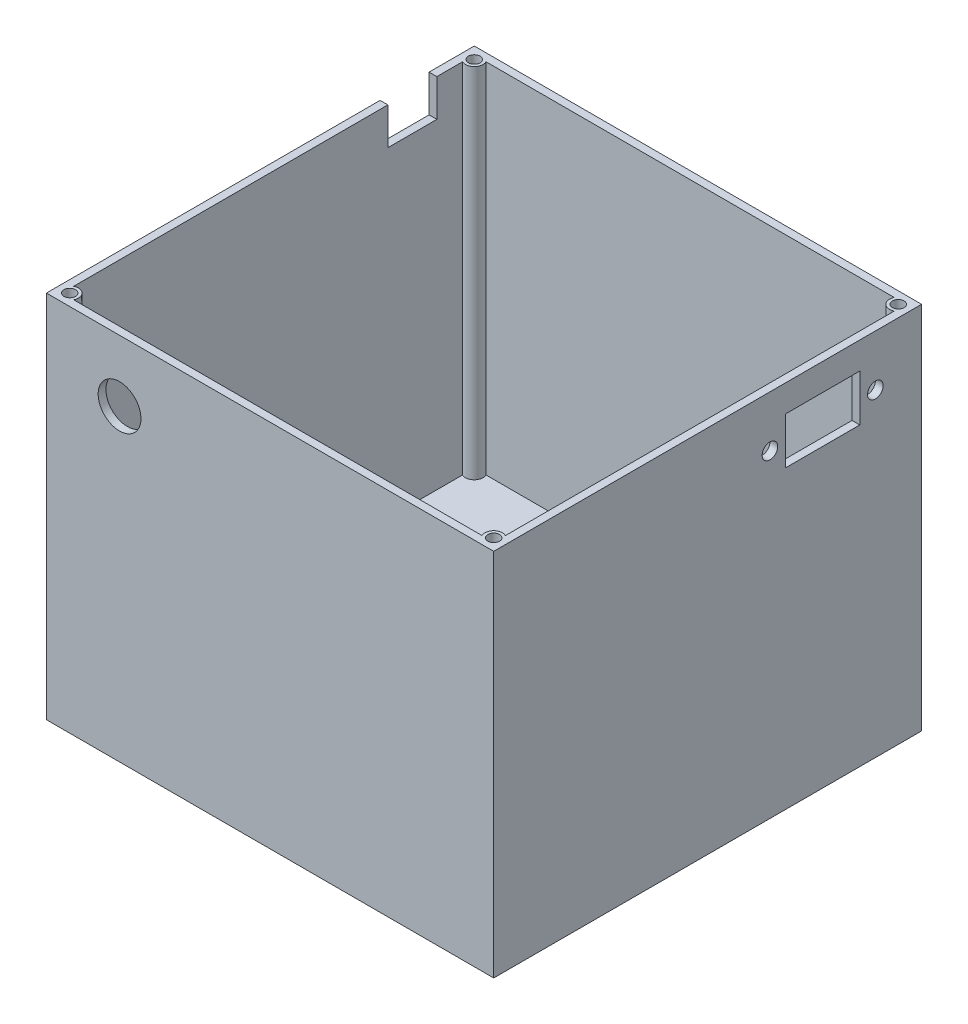
from build123d import *

# Parameters (mm, degrees)
SKETCH1_W           = 115
SKETCH1_H           = 110
SKETCH1_R           = 1.5
BOSS_EXTRUDE6_DEPTH = 92
SKETCH2_W           = 115
SKETCH2_H           = 110
BOSS_EXTRUDE7_DEPTH = 3
SKETCH3_R           = 1.5
BOSS_EXTRUDE8_DEPTH = 35
SKETCH4_R           = 5.5
SKETCH4_R_2         = 1.75
SKETCH4_W           = 19.1
SKETCH4_H           = 12
CUT_EXTRUDE1_DEPTH  = 10
SKETCH8_W           = 8.125191058
SKETCH8_H           = 8.770714661
SKETCH8_H_2         = 7.5
SKETCH8_W_2         = 8.33
CUT_EXTRUDE5_DEPTH  = 10
SKETCH11_W          = 12.596552557
SKETCH11_H          = 9.52641435
CUT_EXTRUDE6_DEPTH  = 10
SKETCH10_R          = 2
SKETCH10_W          = 19.1
SKETCH10_H          = 12
CUT_EXTRUDE7_DEPTH  = 10


with BuildPart() as part:
    # Sketch1 → Boss-Extrude6 (new body)
    with BuildSketch(Plane(origin=(0, 0, 0), x_dir=(1, 0, 0), z_dir=(0, 1, 0))):
        with Locations((227.784784302, -20.136469326)):
            Rectangle(SKETCH1_W, SKETCH1_H)
        with BuildLine():
            Line((175.300348739, 32.863530674), (280.269219865, 32.863530674))
            ThreePointArc((280.269219865, 32.863530674), (280.693794044, 30.272540416), (283.284784302, 29.847966237))
            Line((283.284784302, 29.847966237), (283.284784302, -70.120904889))
            ThreePointArc((283.284784302, -70.120904889), (280.693794044, -70.545479069), (280.269219865, -73.136469326))
            Line((280.269219865, -73.136469326), (175.300348739, -73.136469326))
            ThreePointArc((175.300348739, -73.136469326), (174.87577456, -70.545479069), (172.284784302, -70.120904889))
            Line((172.284784302, -70.120904889), (172.284784302, 29.847966237))
            ThreePointArc((172.284784302, 29.847966237), (174.87577456, 30.272540416), (175.300348739, 32.863530674))
        make_face(mode=Mode.SUBTRACT)
        with Locations((173.284784302, 31.863530674)):
            Circle(SKETCH1_R, mode=Mode.SUBTRACT)
        with Locations((173.284784302, -72.136469326)):
            Circle(SKETCH1_R, mode=Mode.SUBTRACT)
        with Locations((282.284784302, -72.136469326)):
            Circle(SKETCH1_R, mode=Mode.SUBTRACT)
        with Locations((282.284784302, 31.863530674)):
            Circle(SKETCH1_R, mode=Mode.SUBTRACT)
    extrude(amount=BOSS_EXTRUDE6_DEPTH)

    # Sketch2 → Boss-Extrude7 (add)
    with BuildSketch(Plane.XZ):
        with Locations((227.784784302, 20.136469326)):
            Rectangle(SKETCH2_W, SKETCH2_H)
    extrude(amount=BOSS_EXTRUDE7_DEPTH)

    # Sketch3 → Boss-Extrude8 (add)
    with BuildSketch(Plane.XZ.offset(3)):
        with Locations((173.284784302, 72.136469326)):
            Circle(SKETCH3_R)
        with Locations((282.284784302, 72.136469326)):
            Circle(SKETCH3_R)
        with Locations((173.285588499, -31.863530674)):
            Circle(SKETCH3_R)
        with Locations((282.284784302, -31.863530674)):
            Circle(SKETCH3_R)
    extrude(amount=-BOSS_EXTRUDE8_DEPTH)

    # Sketch4 → Cut-Extrude1 (cut)
    with BuildSketch(Plane.XY.offset(75.136469326)):
        with Locations((189.093138972, 76.183507702)):
            Circle(SKETCH4_R)
        with Locations((14.55, -2.085426949)):
            Circle(SKETCH4_R_2)
        with Locations((-14.55, -2.085426949)):
            Circle(SKETCH4_R_2)
        with Locations((0, -1.908878449)):
            Rectangle(SKETCH4_W, SKETCH4_H)
    extrude(amount=-CUT_EXTRUDE1_DEPTH, mode=Mode.SUBTRACT)

    # Sketch8 → Cut-Extrude5 (cut)
    with BuildSketch(Plane.XZ.offset(3)):
        Polygon((196.092008394, 57.480937571), (187.762008394, 57.480937571), (187.762008394, 35.21022291), (196.092008394, 35.21022291), (196.092008394, 42.71022291), (187.930736613, 42.71022291), (187.930736613, 48.71022291), (196.092008394, 48.71022291), align=None)
        with Locations((206.154603923, 53.095580241)):
            Rectangle(SKETCH8_W, SKETCH8_H)
        Polygon((196.092008394, 29.21022291), (187.762008394, 29.21022291), (187.762008394, 8.21022291), (196.092008394, 8.21022291), (196.092008394, 15.71022291), (187.79308657, 15.71022291), (187.79308657, 21.71022291), (196.092008394, 21.71022291), align=None)
        with Locations((206.154603923, 38.96022291)):
            Rectangle(SKETCH8_W, SKETCH8_H_2)
        with Locations((220.597008394, 53.095580241)):
            Rectangle(SKETCH8_W_2, SKETCH8_H)
        with Locations((191.927008394, -1.53977709)):
            Rectangle(SKETCH8_W_2, SKETCH8_H_2)
        with Locations((206.154603923, 25.46022291)):
            Rectangle(SKETCH8_W, SKETCH8_H_2)
        with Locations((206.154603923, 11.96022291)):
            Rectangle(SKETCH8_W, SKETCH8_H_2)
        with Locations((220.597008394, 38.96022291)):
            Rectangle(SKETCH8_W_2, SKETCH8_H_2)
        with Locations((234.927008394, 53.095580241)):
            Rectangle(SKETCH8_W_2, SKETCH8_H)
        Polygon((196.092008394, -11.28977709), (187.762008394, -11.28977709), (187.762008394, -17.519062429), (267.762008394, -17.519062429), (267.762008394, 29.21022291), (259.422008394, 29.21022291), (259.422008394, 21.71022291), (267.630111484, 21.71022291), (267.630111484, 15.71022291), (259.422008394, 15.71022291), (259.422008394, 8.21022291), (267.630111484, 8.21022291), (267.630111484, 2.21022291), (259.422008394, 2.21022291), (259.422008394, -5.28977709), (267.630111484, -5.28977709), (267.630111484, -11.28977709), (259.422008394, -11.28977709), (259.422008394, -17.268554609), (253.422008394, -17.268554609), (253.422008394, -11.28977709), (245.092008394, -11.28977709), (245.092008394, -17.268554609), (239.092008394, -17.268554609), (239.092008394, -11.28977709), (230.762008394, -11.28977709), (230.762008394, -17.467292793), (224.762008394, -17.467292793), (224.762008394, -11.28977709), (216.432008394, -11.28977709), (216.432008394, -17.268554609), (210.217199452, -17.268554609), (210.217199452, -11.28977709), (202.092008394, -11.28977709), (202.092008394, -17.268554609), (196.092008394, -17.268554609), align=None)
        with Locations((206.154603923, -1.53977709)):
            Rectangle(SKETCH8_W, SKETCH8_H_2)
        with Locations((220.597008394, 25.46022291)):
            Rectangle(SKETCH8_W_2, SKETCH8_H_2)
        with Locations((220.597008394, 11.96022291)):
            Rectangle(SKETCH8_W_2, SKETCH8_H_2)
        with Locations((234.927008394, 38.96022291)):
            Rectangle(SKETCH8_W_2, SKETCH8_H_2)
        with Locations((249.257008394, 53.095580241)):
            Rectangle(SKETCH8_W_2, SKETCH8_H)
        with Locations((220.597008394, -1.53977709)):
            Rectangle(SKETCH8_W_2, SKETCH8_H_2)
        with Locations((234.927008394, 25.46022291)):
            Rectangle(SKETCH8_W_2, SKETCH8_H_2)
        with Locations((234.927008394, 11.96022291)):
            Rectangle(SKETCH8_W_2, SKETCH8_H_2)
        with Locations((249.257008394, 38.96022291)):
            Rectangle(SKETCH8_W_2, SKETCH8_H_2)
        Polygon((267.762008394, 57.480937571), (259.422008394, 57.480937571), (259.422008394, 48.71022291), (267.630111484, 48.71022291), (267.630111484, 42.71022291), (259.422008394, 42.71022291), (259.422008394, 35.21022291), (267.762008394, 35.21022291), align=None)
        with Locations((234.927008394, -1.53977709)):
            Rectangle(SKETCH8_W_2, SKETCH8_H_2)
        with Locations((249.257008394, 25.46022291)):
            Rectangle(SKETCH8_W_2, SKETCH8_H_2)
        with Locations((249.257008394, 11.96022291)):
            Rectangle(SKETCH8_W_2, SKETCH8_H_2)
        with Locations((249.257008394, -1.53977709)):
            Rectangle(SKETCH8_W_2, SKETCH8_H_2)
    extrude(amount=-CUT_EXTRUDE5_DEPTH, mode=Mode.SUBTRACT)

    # Sketch11 → Cut-Extrude6 (cut)
    with BuildSketch(Plane.ZY.offset(-170.284784302)):
        with Locations((-16.948902791, 87.236792825)):
            Rectangle(SKETCH11_W, SKETCH11_H)
    extrude(amount=-CUT_EXTRUDE6_DEPTH, mode=Mode.SUBTRACT)

    # Sketch10 → Cut-Extrude7 (cut)
    with BuildSketch(Plane(origin=(285.284784302, 0, 0), x_dir=(0, 0, -1), z_dir=(1, 0, 0))):
        with Locations((22.972537677, 78.855598834)):
            Circle(SKETCH10_R)
        with Locations((-4.127462323, 78.855598834)):
            Circle(SKETCH10_R)
        with Locations((9.422537677, 79.076906697)):
            Rectangle(SKETCH10_W, SKETCH10_H)
    extrude(amount=-CUT_EXTRUDE7_DEPTH, mode=Mode.SUBTRACT)


solid = part.part
